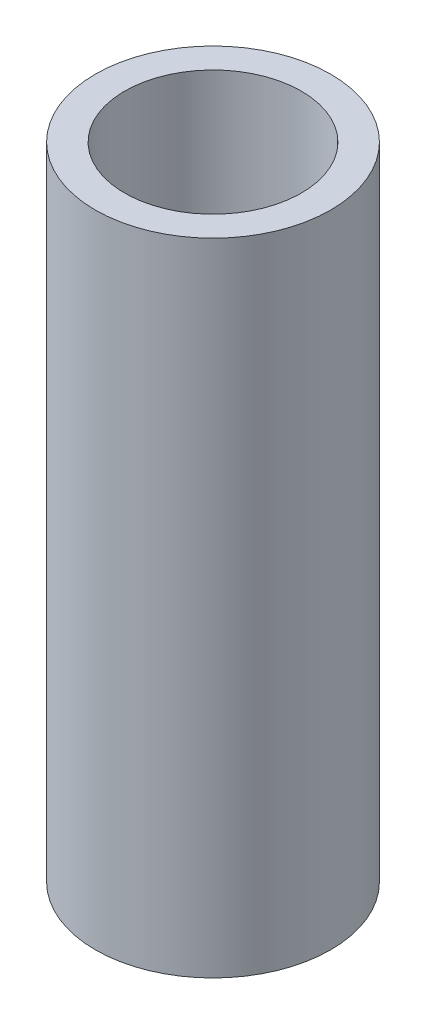
from build123d import *

# Parameters (mm, degrees)
SKETCH1_R           = 20
BOSS_EXTRUDE1_DEPTH = 108.88206263
SKETCH2_R           = 15.016472569
CUT_EXTRUDE1_DEPTH  = 113.495793533


with BuildPart() as part:
    # Sketch1 → Boss-Extrude1 (new body)
    with BuildSketch(Plane(origin=(0, 0, 0), x_dir=(1, 0, 0), z_dir=(0, 1, 0))):
        Circle(SKETCH1_R)
    extrude(amount=BOSS_EXTRUDE1_DEPTH)

    # Sketch2 → Cut-Extrude1 (cut, through all)
    with BuildSketch(Plane(origin=(0, 0, 0), x_dir=(1, 0, 0), z_dir=(0, 1, 0))):
        Circle(SKETCH2_R)
    extrude(amount=CUT_EXTRUDE1_DEPTH, mode=Mode.SUBTRACT)


solid = part.part
